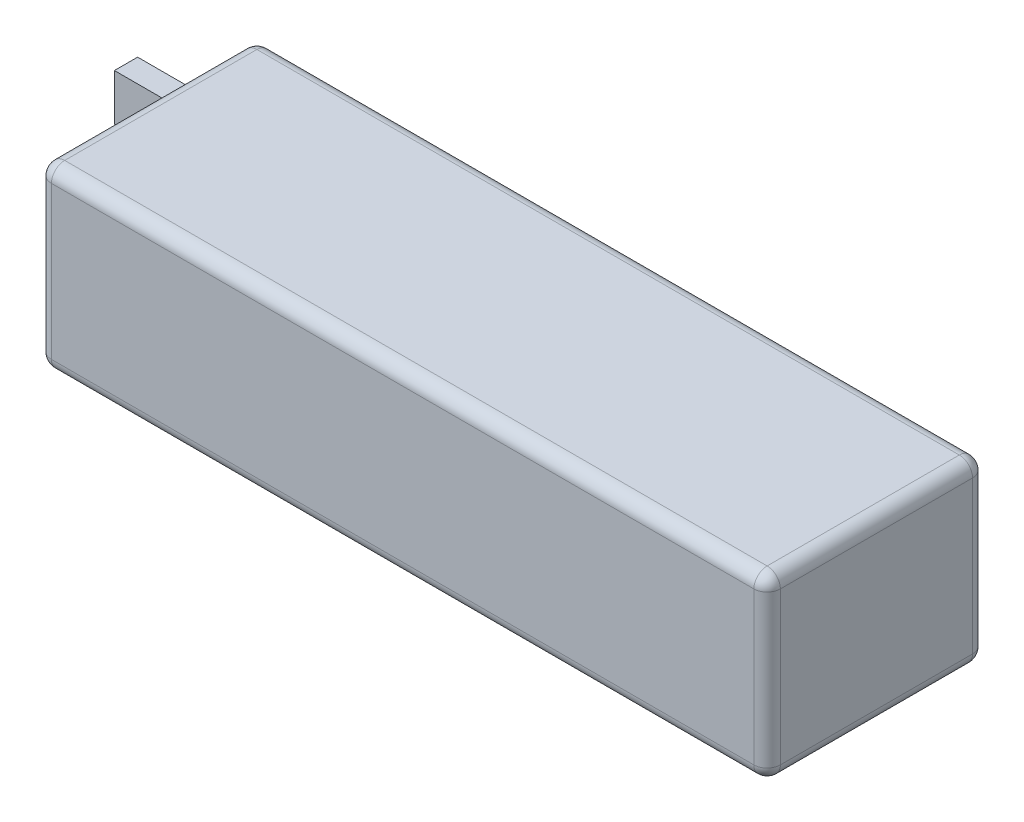
from build123d import *

# Parameters (mm, degrees)
ESBO_O2_W                = 110
ESBO_O2_H                = 33
RESSALTO_EXTRUS_O1_DEPTH = 27
FILETE1_R                = 2
ESBO_O3_W                = 3.5
ESBO_O3_H                = 7
RESSALTO_EXTRUS_O2_DEPTH = 16


with BuildPart() as part:
    # Esboço2 → Ressalto-extrusão1 (new body)
    with BuildSketch(Plane(origin=(0, 0, 0), x_dir=(1, 0, 0), z_dir=(0, 1, 0))):
        with Locations((55, 16.5)):
            Rectangle(ESBO_O2_W, ESBO_O2_H)
    extrude(amount=RESSALTO_EXTRUS_O1_DEPTH)

    # Filete1
    filete1_edges = [part.edges().sort_by_distance(p)[0] for p in [
        (0, 13.5, -33),
        (110, 13.5, -33),
        (0, 13.5, 0),
        (110, 13.5, 0),
        (55, 27, -33),
        (110, 27, -16.5),
        (55, 27, 0),
        (0, 27, -16.5),
        (55, 0, 0),
        (110, 0, -16.5),
        (55, 0, -33),
        (0, 0, -16.5),
    ]]
    fillet(filete1_edges, radius=FILETE1_R)

    # Esboço3 → Ressalto-extrusão2 (add)
    with BuildSketch(Plane.ZY):
        with Locations((-29.25, 13.5)):
            Rectangle(ESBO_O3_W, ESBO_O3_H)
    extrude(amount=RESSALTO_EXTRUS_O2_DEPTH)


solid = part.part
